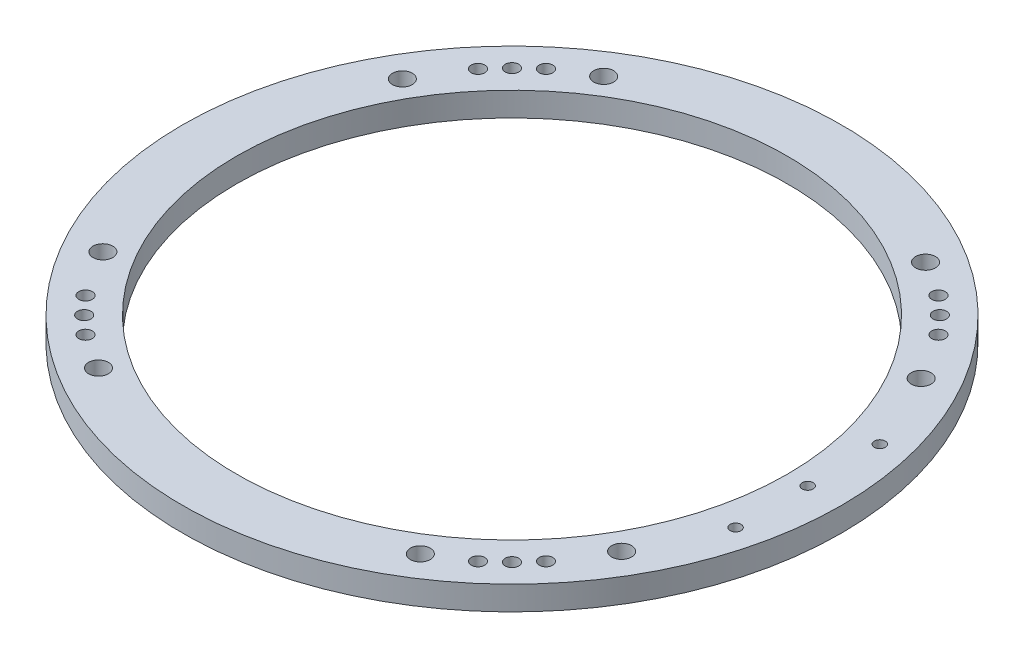
from build123d import *

# Parameters (mm, degrees)
F_9_32_0_28125_DIAMETER_HOLE1_D = 7.14375
CIRPATTERN1_COUNT               = 4
M5_CLEARANCE_HOLE1_D            = 5.8
Z_0_413_DIAMETER_HOLE1_D        = 10.4902


with BuildPart() as part:
    # Sketch1 → Revolve1 (revolve)
    with BuildSketch(Plane.XY):
        Polygon((145.526233777, 1064.895), (145.526233777, 1052.195), (152.4, 1052.195), (174.101233777, 1052.195), (174.101233777, 1064.895), align=None)
    revolve(axis=Axis((0, 1125.81516809, 0), (0, -1, 0)))

    # 9/32 (0.28125) Diameter Hole1 (through all)
    with Locations(Plane(origin=(0, 1052.195, 0), x_dir=(-1, 0, 0), z_dir=(0, -1, 0))):
        with Locations((103.667734326, 121.628246568), (121.628246568, 103.667734326), (113.00537488, 113.00537488)):
            f_9_32_0_28125_diameter_hole1 = Hole(F_9_32_0_28125_DIAMETER_HOLE1_D / 2)

    # CirPattern1: 9/32 (0.28125) Diameter Hole1 ×4 about axis
    cirpattern1_axis = Axis((0, 1125.81516809, 0), (0, 1, 0))
    for i in range(1, CIRPATTERN1_COUNT):
        add(f_9_32_0_28125_diameter_hole1.rotate(cirpattern1_axis, i * 360 / CIRPATTERN1_COUNT), mode=Mode.SUBTRACT)

    # M5 Clearance Hole1 (through all)
    with Locations(Plane(origin=(0, 1064.895, 0), x_dir=(1, 0, 0), z_dir=(0, 1, 0))):
        with Locations((156.21, -38.1), (156.21, 0), (156.21, 38.1)):
            Hole(M5_CLEARANCE_HOLE1_D / 2)

    # Z (0.413) Diameter Hole1 (through all)
    with Locations(Plane(origin=(0, 1064.895, 0), x_dir=(1, 0, 0), z_dir=(0, 1, 0))):
        with Locations((-137.027937996, -79.113116888), (137.027937996, -79.113116888), (137.027937996, 79.113116888), (-137.027937996, 79.113116888), (-85.014893438, 133.44665207), (85.014893438, 133.44665207), (85.014893438, -133.44665207), (-85.014893438, -133.44665207)):
            Hole(Z_0_413_DIAMETER_HOLE1_D / 2)


solid = part.part
